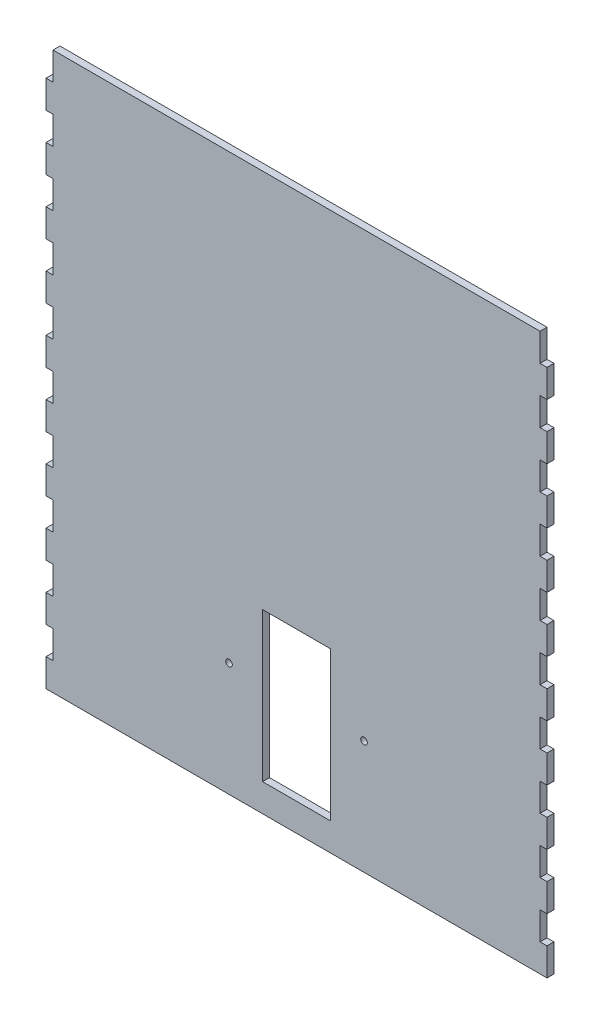
from build123d import *

# Parameters (mm, degrees)
SKETCH1_W           = 3.175
SKETCH1_H           = 12.7
BOSS_EXTRUDE1_DEPTH = 3.175
SKETCH2_R           = 1.5
SKETCH2_W           = 31
SKETCH2_H           = 68
CUT_EXTRUDE1_DEPTH  = 171.890522338


with BuildPart() as part:
    # Sketch1 → Boss-Extrude1 (new body)
    with BuildSketch(Plane.XY):
        Polygon((-111.125, 127), (-111.125, 114.3), (-111.125, 101.6), (-111.125, 88.9), (-111.125, 76.2), (-111.125, 63.5), (-111.125, 50.8), (-111.125, 38.1), (-111.125, 25.4), (-111.125, 12.7), (-111.125, 0), (-111.125, -12.7), (-111.125, -25.4), (-111.125, -38.1), (-111.125, -50.8), (-111.125, -63.5), (-111.125, -76.2), (-111.125, -88.9), (-111.125, -101.6), (-111.125, -114.3), (-111.125, -127), (0, -127), (0, 127), align=None)
        Polygon((111.125, 127), (0, 127), (0, -127), (111.125, -127), (111.125, -114.3), (111.125, -101.6), (111.125, -88.9), (111.125, -76.2), (111.125, -63.5), (111.125, -50.8), (111.125, -38.1), (111.125, -25.4), (111.125, -12.7), (111.125, 0), (111.125, 12.7), (111.125, 25.4), (111.125, 38.1), (111.125, 50.8), (111.125, 63.5), (111.125, 76.2), (111.125, 88.9), (111.125, 101.6), (111.125, 114.3), align=None)
        with Locations((-112.7125, -120.65)):
            Rectangle(SKETCH1_W, SKETCH1_H)
        with Locations((-112.7125, -95.25)):
            Rectangle(SKETCH1_W, SKETCH1_H)
        with Locations((-112.7125, -69.85)):
            Rectangle(SKETCH1_W, SKETCH1_H)
        with Locations((-112.7125, -44.45)):
            Rectangle(SKETCH1_W, SKETCH1_H)
        with Locations((-112.7125, -19.05)):
            Rectangle(SKETCH1_W, SKETCH1_H)
        with Locations((-112.7125, 6.35)):
            Rectangle(SKETCH1_W, SKETCH1_H)
        with Locations((-112.7125, 31.75)):
            Rectangle(SKETCH1_W, SKETCH1_H)
        with Locations((-112.7125, 57.15)):
            Rectangle(SKETCH1_W, SKETCH1_H)
        with Locations((-112.7125, 82.55)):
            Rectangle(SKETCH1_W, SKETCH1_H)
        with Locations((-112.7125, 107.95)):
            Rectangle(SKETCH1_W, SKETCH1_H)
        with Locations((112.7125, -120.65)):
            Rectangle(SKETCH1_W, SKETCH1_H)
        with Locations((112.7125, -95.25)):
            Rectangle(SKETCH1_W, SKETCH1_H)
        with Locations((112.7125, -69.85)):
            Rectangle(SKETCH1_W, SKETCH1_H)
        with Locations((112.7125, -44.45)):
            Rectangle(SKETCH1_W, SKETCH1_H)
        with Locations((112.7125, -19.05)):
            Rectangle(SKETCH1_W, SKETCH1_H)
        with Locations((112.7125, 6.35)):
            Rectangle(SKETCH1_W, SKETCH1_H)
        with Locations((112.7125, 31.75)):
            Rectangle(SKETCH1_W, SKETCH1_H)
        with Locations((112.7125, 57.15)):
            Rectangle(SKETCH1_W, SKETCH1_H)
        with Locations((112.7125, 82.55)):
            Rectangle(SKETCH1_W, SKETCH1_H)
        with Locations((112.7125, 107.95)):
            Rectangle(SKETCH1_W, SKETCH1_H)
    extrude(amount=BOSS_EXTRUDE1_DEPTH)

    # Sketch2 → Cut-Extrude1 (cut, through all)
    with BuildSketch(Plane.XY.offset(3.175)):
        with Locations((-30.8, -75.06239569)):
            Circle(SKETCH2_R)
        with Locations((30.8, -75.06239569)):
            Circle(SKETCH2_R)
        with Locations((0, -80.3)):
            Rectangle(SKETCH2_W, SKETCH2_H)
    extrude(amount=-CUT_EXTRUDE1_DEPTH, mode=Mode.SUBTRACT)


solid = part.part
